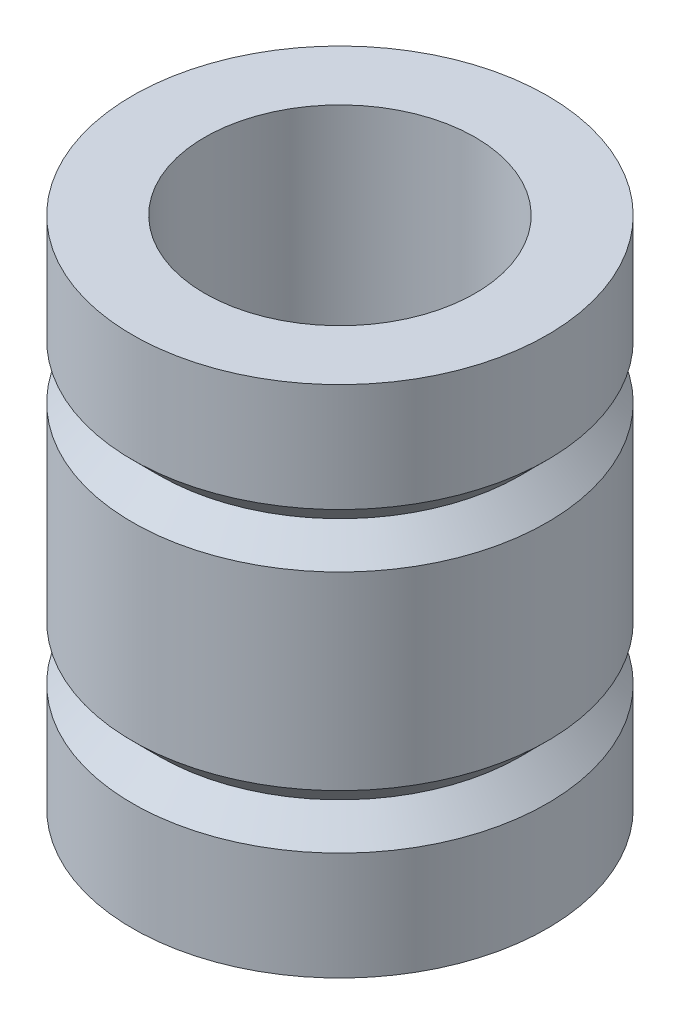
from build123d import *


with BuildPart() as part:
    # Sketch1 → Revolve1 (revolve)
    with BuildSketch(Plane.XY):
        Polygon((1.5, 0), (2.3, 0), (2.3, -1.2), (2, -1.5), (2.3, -1.8), (2.3, -3.9), (2, -4.2), (2.3, -4.5), (2.3, -5.7), (1.5, -5.7), align=None)
    revolve(axis=Axis((0, -10, 0), (0, 1, 0)))


solid = part.part
